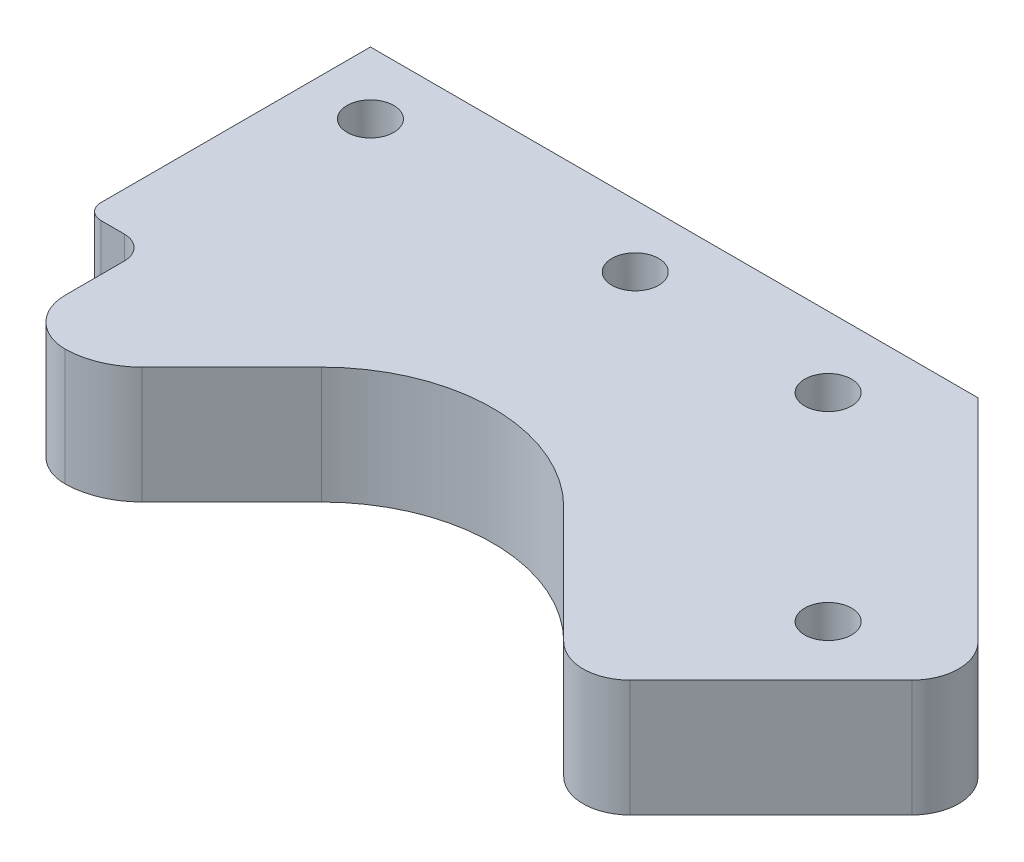
from build123d import *

# Parameters (mm, degrees)
SKETCH3_R           = 1.5
BOSS_EXTRUDE1_DEPTH = 8
BOSS_EXTRUDE2_DEPTH = 8
BOSS_EXTRUDE3_DEPTH = 20
SKETCH10_R          = 7.5
SKETCH10_R_2        = 5
BOSS_EXTRUDE4_DEPTH = 10
FILLET1_R           = 3
CUT_EXTRUDE1_DEPTH  = 0.5
CUT_EXTRUDE2_START  = -0.5
CUT_EXTRUDE2_DEPTH  = 0.5
CHAMFER1_SIZE       = 3
SKETCH13_W          = 9.116659412
SKETCH13_H          = 8
BOSS_EXTRUDE5_DEPTH = 21
FILLET2_R           = 15
FILLET3_R           = 5
BOSS_EXTRUDE6_DEPTH = 7.5
SKETCH15_W          = 25
SKETCH15_H          = 10.000000005
CUT_EXTRUDE3_DEPTH  = 3
SKETCH17_W          = 25
SKETCH17_H          = 10.000000005
CUT_EXTRUDE4_DEPTH  = 3
FILLET4_R           = 3
SKETCH18_R          = 1.5
CUT_EXTRUDE5_DEPTH  = 36
SKETCH19_W          = 63.521473438
SKETCH19_H          = 44.294667312
CUT_EXTRUDE6_DEPTH  = 28.5
CHAMFER2_SIZE       = 1.5
FILLET5_R           = 1


with BuildPart() as part:
    # Sketch3 → Boss-Extrude1 (new body)
    with BuildSketch(Plane.XZ.offset(-5.496710387)):
        with BuildLine():
            Line((-58.572275019, 18.935598634), (-63.572275019, 18.935598634))
            Line((-63.572275019, 18.935598634), (-63.572275019, 5.639753178))
            Line((-63.572275019, 5.639753178), (-58.572275019, -7.656092278))
            Line((-58.572275019, -7.656092278), (-28.572248892, -7.656092278))
            Line((-28.572248892, -7.656092278), (-12.876703256, 8.039453359))
            Line((-12.876703256, 8.039453359), (-26.172535648, 21.335285751))
            Line((-26.172535648, 21.335285751), (-35.794074299, 11.7137471))
            ThreePointArc((-35.794074299, 11.7137471), (-43.572248892, 8.491921693), (-51.350423485, 11.7137471))
            Line((-51.350423485, 11.7137471), (-58.572275019, 18.935598634))
        make_face()
        with Locations((-33.672753955, -3.135495305)):
            Circle(SKETCH3_R, mode=Mode.SUBTRACT)
        with Locations((-20.944831894, 9.592426757)):
            Circle(SKETCH3_R, mode=Mode.SUBTRACT)
    extrude(amount=BOSS_EXTRUDE1_DEPTH)



with BuildPart() as body_2:
    # Sketch4 → Boss-Extrude2 (new body)
    with BuildSketch(Plane(origin=(0, 25.496710387, 0), x_dir=(1, 0, 0), z_dir=(0, 1, 0))):
        with BuildLine():
            Line((-65.072275019, -10.639753178), (-67.573393534, -10.639753178))
            Line((-67.573393534, -10.639753178), (-67.573393534, 7.656092278))
            Line((-67.573393534, 7.656092278), (-28.572248892, 7.656092278))
            Line((-28.572248892, 7.656092278), (-12.876703256, -8.039453359))
            Line((-12.876703256, -8.039453359), (-26.172535648, -21.335285751))
            Line((-26.172535648, -21.335285751), (-35.794074299, -11.7137471))
            ThreePointArc((-35.794074299, -11.7137471), (-43.572248892, -8.491921693), (-51.350423485, -11.7137471))
            Line((-51.350423485, -11.7137471), (-58.572275019, -18.935598634))
            Line((-58.572275019, -18.935598634), (-63.572275019, -18.935598634))
            Line((-63.572275019, -18.935598634), (-63.572275019, -12.139753178))
            ThreePointArc((-63.572275019, -12.139753178), (-64.011614847, -11.079093006), (-65.072275019, -10.639753178))
        make_face()
    extrude(amount=BOSS_EXTRUDE2_DEPTH)


with BuildPart() as part_1:
    add(part.part)

    add(body_2.part)  # Boss-Extrude3 merges body 2
    # Sketch9 → Boss-Extrude3 (add)
    with BuildSketch(Plane.XZ.offset(-25.496710387)):
        Polygon((-34.709554416, -7.656092278), (-42.709554416, 0.343907722), (-58.456734122, 0.343907722), (-58.456734122, -7.656092278), align=None)
    extrude(amount=BOSS_EXTRUDE3_DEPTH)

    # Sketch10 → Boss-Extrude4 (add)
    with BuildSketch(Plane(origin=(0, 0, -7.656092278), x_dir=(-1, 0, 0), z_dir=(0, 0, -1))):
        with Locations(Location((43.572275019, 15.496710387, 0), (0, 0, 180))):
            Circle(SKETCH10_R)
        with Locations((43.572275019, 15.496710387)):
            Circle(SKETCH10_R_2, mode=Mode.SUBTRACT)
    extrude(amount=BOSS_EXTRUDE4_DEPTH)

    # Fillet1
    fillet1_edges = [part_1.edges().sort_by_distance(p)[0] for p in [
        (-63.572275019, 1.496710387, 18.935598634),
        (-26.172535648, 1.496710387, 21.335285751),
        (-12.876703256, 1.496710387, 8.039453359),
        (-63.572275019, 29.496710387, 18.935598634),
        (-26.172535648, 29.496710387, 21.335285751),
        (-12.876703256, 29.496710387, 8.039453359),
    ]]
    fillet(fillet1_edges, radius=FILLET1_R)

    # Sketch11 → Cut-Extrude1 (cut)
    with BuildSketch(Plane.XZ.offset(-25.496710387)):
        with BuildLine():
            Line((-58.572275019, 18.935598634), (-60.572275019, 18.935598634))
            ThreePointArc((-60.572275019, 18.935598634), (-62.693595362, 18.056918977), (-63.572275019, 15.935598634))
            Line((-63.572275019, 15.935598634), (-63.572275019, 12.139753178))
            ThreePointArc((-63.572275019, 12.139753178), (-64.011614847, 11.079093006), (-65.072275019, 10.639753178))
            Line((-65.072275019, 10.639753178), (-67.573393534, 10.639753178))
            Line((-67.573393534, 10.639753178), (-67.573393534, -7.656092278))
            Line((-67.573393534, -7.656092278), (-58.456734122, -7.656092278))
            Line((-58.456734122, -7.656092278), (-58.456734122, 0.343907722))
            Line((-58.456734122, 0.343907722), (-42.709554416, 0.343907722))
            Line((-42.709554416, 0.343907722), (-34.709554416, -7.656092278))
            Line((-34.709554416, -7.656092278), (-28.572248892, -7.656092278))
            Line((-28.572248892, -7.656092278), (-14.998023599, 5.918133015))
            ThreePointArc((-14.998023599, 5.918133015), (-14.119343943, 8.039453359), (-14.998023599, 10.160773702))
            Line((-14.998023599, 10.160773702), (-24.051215304, 19.213965408))
            ThreePointArc((-24.051215304, 19.213965408), (-26.172535648, 20.092645064), (-28.293855992, 19.213965408))
            Line((-28.293855992, 19.213965408), (-35.794074299, 11.7137471))
            ThreePointArc((-35.794074299, 11.7137471), (-43.572248892, 8.491921693), (-51.350423485, 11.7137471))
            Line((-51.350423485, 11.7137471), (-58.572275019, 18.935598634))
        make_face()
    extrude(amount=-CUT_EXTRUDE1_DEPTH, mode=Mode.SUBTRACT)

    # Sketch12 → Cut-Extrude2 (cut)
    with BuildSketch(Plane(origin=(0, 5.496710387, 0), x_dir=(1, 0, 0), z_dir=(0, 1, 0)).offset(CUT_EXTRUDE2_START)):
        with BuildLine():
            Line((-67.573393534, -10.639753178), (-65.072275019, -10.639753178))
            ThreePointArc((-65.072275019, -10.639753178), (-64.011614847, -11.079093006), (-63.572275019, -12.139753178))
            Line((-63.572275019, -12.139753178), (-63.572275019, -15.935598634))
            ThreePointArc((-63.572275019, -15.935598634), (-62.693595362, -18.056918977), (-60.572275019, -18.935598634))
            Line((-60.572275019, -18.935598634), (-58.572275019, -18.935598634))
            Line((-58.572275019, -18.935598634), (-51.350423485, -11.7137471))
            ThreePointArc((-51.350423485, -11.7137471), (-43.572248892, -8.491921693), (-35.794074299, -11.7137471))
            Line((-35.794074299, -11.7137471), (-28.293855992, -19.213965408))
            ThreePointArc((-28.293855992, -19.213965408), (-26.172535648, -20.092645064), (-24.051215304, -19.213965408))
            Line((-24.051215304, -19.213965408), (-14.998023599, -10.160773702))
            ThreePointArc((-14.998023599, -10.160773702), (-14.119343943, -8.039453359), (-14.998023599, -5.918133015))
            Line((-14.998023599, -5.918133015), (-28.572248892, 7.656092278))
            Line((-28.572248892, 7.656092278), (-34.709554416, 7.656092278))
            Line((-34.709554416, 7.656092278), (-42.709554416, -0.343907722))
            Line((-42.709554416, -0.343907722), (-58.456734122, -0.343907722))
            Line((-58.456734122, -0.343907722), (-58.456734122, 7.656092278))
            Line((-58.456734122, 7.656092278), (-58.572275019, 7.656092278))
            Line((-58.572275019, 7.656092278), (-62.841209361, -3.695725977))
            ThreePointArc((-62.841209361, -3.695725977), (-63.941577707, -5.106321482), (-65.64921959, -5.639753178))
            Line((-65.64921959, -5.639753178), (-67.573393534, 7.656092278))
            Line((-67.573393534, 7.656092278), (-67.573393534, -10.639753178))
        make_face()
    extrude(amount=CUT_EXTRUDE2_DEPTH, mode=Mode.SUBTRACT)

    # Chamfer1
    # the kernel refuses this chamfer: 3 mm, written as the material it adds along each edge
    with BuildSketch(Plane(origin=(-43.572275019, 15.496710387, -7.656092278), x_dir=(1, 0, 0), z_dir=(0, 1, 0))) as chamfer1_piece_1_section:
        Polygon((7.5 + CHAMFER1_SIZE, 0), (7.5, CHAMFER1_SIZE), (7.5, 0), align=None)
    chamfer1_piece_1 = revolve(axis=Axis((-43.572275019, 15.496710387, -7.656092278), (0, 0, -1)), mode=Mode.PRIVATE)
    chamfer1_piece_1 = split(chamfer1_piece_1, bisect_by=Plane(origin=(-42.890914717, 15.496710387, 0.525268024), z_dir=(-0.7071067811865474, 0, -0.7071067811865477)), keep=Keep.TOP, mode=Mode.PRIVATE)
    add(chamfer1_piece_1)

    # Sketch13 → Boss-Extrude5 (add)
    with BuildSketch(Plane.XZ.offset(-25.996710387)):
        with Locations((-63.015063828, -3.656092278)):
            Rectangle(SKETCH13_W, SKETCH13_H)
    extrude(amount=BOSS_EXTRUDE5_DEPTH)

    # Fillet2
    fillet2_edges = [part_1.edges().sort_by_distance(p)[0] for p in [
        (-63.572275019, 1.246710387, 5.639753178),
    ]]
    fillet(fillet2_edges, radius=FILLET2_R)

    # Fillet3
    # the kernel refuses this fillet: 5 mm, written as the material it takes off along each edge
    with BuildSketch(Plane(origin=(-58.572275019, 20.819040858, 18.935598634), x_dir=(0.7071067811865416, 0, -0.7071067811865536), z_dir=(0, 1, 0)), Plane(origin=(-58.572275019, 10.174379917, 18.935598634), x_dir=(-1, 0, 0), z_dir=(0, -1, 0))) as fillet3_piece_1:
        with BuildLine():
            CenterArc((FILLET3_R * 0.414213562373, FILLET3_R), FILLET3_R, 225, 45)
            Line((-FILLET3_R * 0.292893218813, FILLET3_R * 0.292893218813), (-FILLET3_R * 0.307035354437, FILLET3_R * 0.27875108319))
            Line((-FILLET3_R * 0.307035354437, FILLET3_R * 0.27875108319), (-FILLET3_R * 0.00828427124746, -FILLET3_R * 0.02))
            Line((-FILLET3_R * 0.00828427124746, -FILLET3_R * 0.02), (FILLET3_R * 0.414213562373, -FILLET3_R * 0.02))
            Line((FILLET3_R * 0.414213562373, -FILLET3_R * 0.02), (FILLET3_R * 0.414213562373, 0))
        make_face()
    extrude(amount=17.855339059, mode=Mode.SUBTRACT)

    # Sketch14 → Boss-Extrude6 (add)
    with BuildSketch(Plane.XZ.offset(2.503289613)):
        with BuildLine():
            Line((-62.612326164, 3.087086856), (-58.572275019, -7.656092278))
            Line((-58.572275019, -7.656092278), (-67.573393534, -7.656092278))
            Line((-67.573393534, -7.656092278), (-67.573393534, 10.639753178))
            Line((-67.573393534, 10.639753178), (-65.072275019, 10.639753178))
            ThreePointArc((-65.072275019, 10.639753178), (-64.011614847, 11.079093006), (-63.572275019, 12.139753178))
            Line((-63.572275019, 12.139753178), (-63.572275019, 8.366950853))
            ThreePointArc((-63.572275019, 8.366950853), (-63.330336666, 5.683740759), (-62.612326164, 3.087086856))
        make_face()
    extrude(amount=-BOSS_EXTRUDE6_DEPTH)

    # Sketch15 → Cut-Extrude3 (cut)
    with BuildSketch(Plane.XZ.offset(2.503289613)):
        with Locations((-55.073393534, -2.656092276)):
            Rectangle(SKETCH15_W, SKETCH15_H)
    extrude(amount=-CUT_EXTRUDE3_DEPTH, mode=Mode.SUBTRACT)

    # Sketch17 → Cut-Extrude4 (cut)
    with BuildSketch(Plane(origin=(0, 33.496710387, 0), x_dir=(1, 0, 0), z_dir=(0, 1, 0))):
        with Locations((-55.073393534, 2.656092276)):
            Rectangle(SKETCH17_W, SKETCH17_H)
    extrude(amount=-CUT_EXTRUDE4_DEPTH, mode=Mode.SUBTRACT)

    # Fillet4
    fillet4_edges = [part_1.edges().sort_by_distance(p)[0] for p in [
        (-42.573393534, -1.003289613, 2.343907727),
        (-42.573393534, -1.003289613, -7.656092278),
        (-42.573393534, 31.996710387, 2.343907727),
        (-42.573393534, 31.996710387, -7.656092278),
    ]]
    fillet(fillet4_edges, radius=FILLET4_R)

    # Sketch18 → Cut-Extrude5 (cut)
    with BuildSketch(Plane.XZ.offset(2.503289613)):
        with Locations((-46.573393534, -3.65609228)):
            Circle(SKETCH18_R)
        with Locations((-63.573393534, -3.656092278)):
            Circle(SKETCH18_R)
    extrude(amount=-CUT_EXTRUDE5_DEPTH, mode=Mode.SUBTRACT)

    # Sketch19 → Cut-Extrude6 (cut)
    with BuildSketch(Plane(origin=(0, 33.496710387, 0), x_dir=(1, 0, 0), z_dir=(0, 1, 0))):
        with Locations((-40.836204684, -1.568816282)):
            Rectangle(SKETCH19_W, SKETCH19_H)
    extrude(amount=-CUT_EXTRUDE6_DEPTH, mode=Mode.SUBTRACT)

    # Chamfer2
    chamfer2_edges = [part_1.edges().sort_by_distance(p)[0] for p in [
        (-35.172753955, -2.503289613, -3.135495305),
        (-22.444831894, -2.503289613, 9.592426757),
    ]]
    chamfer(chamfer2_edges, length=CHAMFER2_SIZE)

    # Fillet5
    fillet5_edges = [part_1.edges().sort_by_distance(p)[0] for p in [
        (-67.573393534, 1.246710387, 10.639753178),
    ]]
    fillet(fillet5_edges, radius=FILLET5_R)


solid = part_1.part
